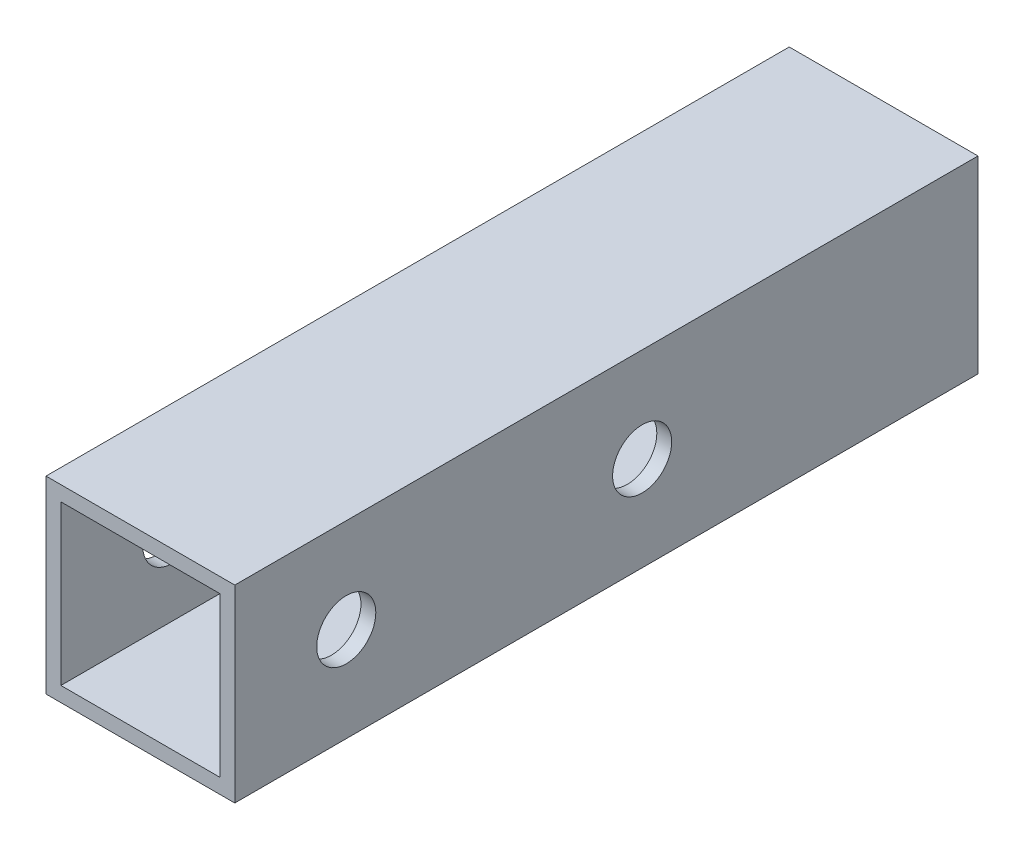
from build123d import *

# Parameters (mm, degrees)
SKETCH1_W           = 25.4
SKETCH1_H           = 25.4
SKETCH1_W_2         = 21.4
SKETCH1_H_2         = 21.4
BOSS_EXTRUDE1_DEPTH = 100
SKETCH2_R           = 3.975
CUT_EXTRUDE1_DEPTH  = 50
CUT_EXTRUDE4_DEPTH  = 10
SKETCH4_R           = 1.778
CUT_EXTRUDE5_DEPTH  = 10


with BuildPart() as part:
    # Sketch1 → Boss-Extrude1 (new body)
    with BuildSketch(Plane.XY):
        with Locations((12.7, 12.7)):
            Rectangle(SKETCH1_W, SKETCH1_H)
        with Locations((12.7, 12.7)):
            Rectangle(SKETCH1_W_2, SKETCH1_H_2, mode=Mode.SUBTRACT)
    extrude(amount=BOSS_EXTRUDE1_DEPTH)

    # Sketch2 → Cut-Extrude1 (cut)
    with BuildSketch(Plane(origin=(25.4, 0, 0), x_dir=(0, 0, -1), z_dir=(1, 0, 0))):
        with Locations((-85, 12.7)):
            Circle(SKETCH2_R)
        with Locations((-45.19, 12.7)):
            Circle(SKETCH2_R)
    extrude(amount=-CUT_EXTRUDE1_DEPTH, mode=Mode.SUBTRACT)

    # Sketch3 → Cut-Extrude4 (cut)
    with BuildSketch(Plane.XZ):
        with BuildLine():
            ThreePointArc((8.45, 70), (6.9, 71.55), (5.35, 70))
            Line((5.35, 70), (5.35, 10))
            ThreePointArc((5.35, 10), (6.9, 8.45), (8.45, 10))
            Line((8.45, 10), (8.45, 70))
        make_face()
    extrude(amount=-CUT_EXTRUDE4_DEPTH, mode=Mode.SUBTRACT)

    # Sketch4 → Cut-Extrude5 (cut)
    with BuildSketch(Plane.XZ):
        with Locations((7.5, 2.765729771)):
            Circle(SKETCH4_R)
        with Locations((17.5, 2.765729771)):
            Circle(SKETCH4_R)
    extrude(amount=-CUT_EXTRUDE5_DEPTH, mode=Mode.SUBTRACT)


solid = part.part
